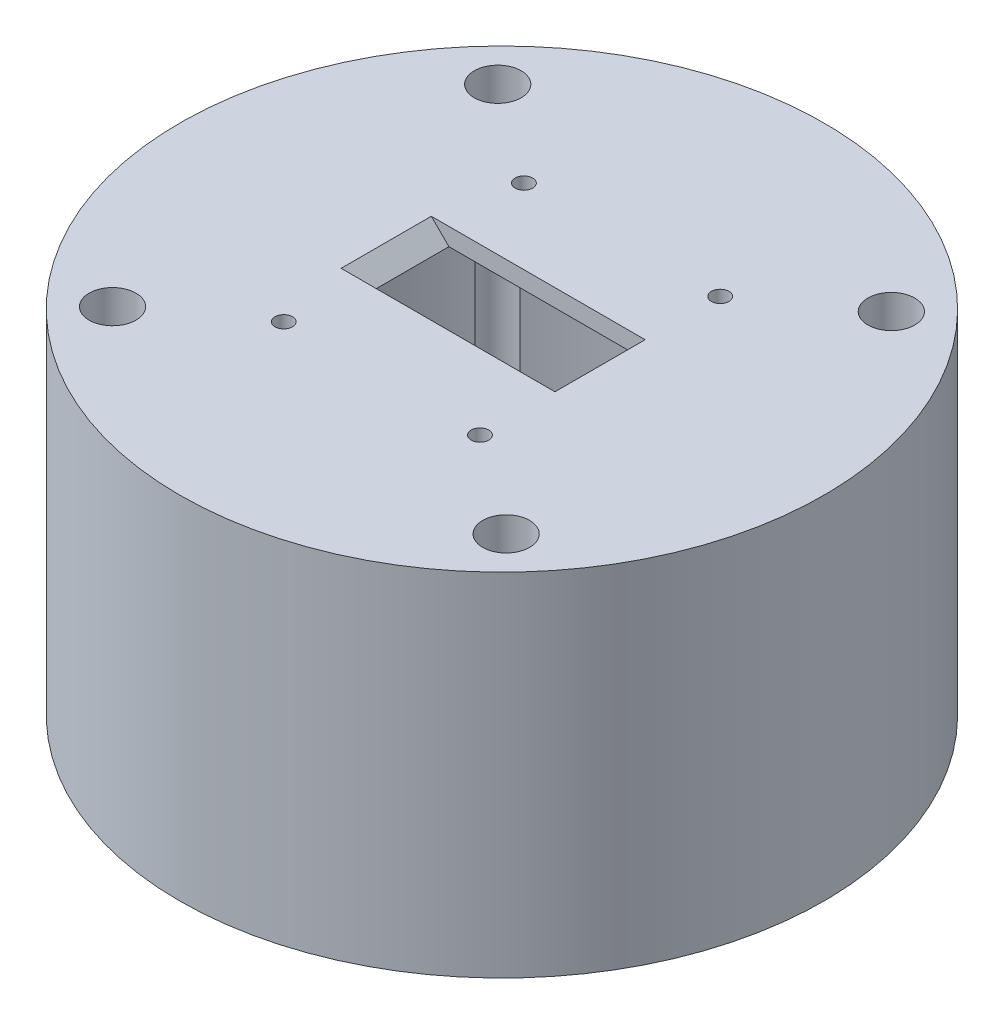
from build123d import *

# Parameters (mm, degrees)
SKETCH_1_R          = 55
EXTRUDE_1_DEPTH     = 60
SKETCH_2_R          = 50
CUT_EXTRUDE_1_DEPTH = 50
SKETCH_3_W          = 33.5
SKETCH_3_H          = 15.4
CUT_EXTRUDE_2_DEPTH = 93.466210045
SKETCH_4_R          = 1.5
SKETCH_4_R_2        = 4
CUT_EXTRUDE_3_DEPTH = 99.234413522
CUT_EXTRUDE_4_DEPTH = 7
CHAMFER_1_SIZE      = 3


with BuildPart() as part:
    # Эскиз1 → Бобышка-Вытянуть1 (new body)
    with BuildSketch(Plane(origin=(0, 0, 0), x_dir=(1, 0, 0), z_dir=(0, 1, 0))):
        with Locations(Location((0, 0, 0), (0, 0, 270))):
            Circle(SKETCH_1_R)
    extrude(amount=EXTRUDE_1_DEPTH)

    # Эскиз2 → Вырез-Вытянуть1 (cut)
    with BuildSketch(Plane.XZ):
        with Locations(Location((0, 0, 0), (0, 0, 270))):
            Circle(SKETCH_2_R)
    extrude(amount=-CUT_EXTRUDE_1_DEPTH, mode=Mode.SUBTRACT)

    # Эскиз3 → Вырез-Вытянуть2 (cut, through all)
    with BuildSketch(Plane.XZ.offset(-50)):
        Rectangle(SKETCH_3_W, SKETCH_3_H)
    extrude(amount=-CUT_EXTRUDE_2_DEPTH, mode=Mode.SUBTRACT)

    # Эскиз4 → Вырез-Вытянуть3 (cut, through all)
    with BuildSketch(Plane(origin=(0, 60, 0), x_dir=(1, 0, 0), z_dir=(0, 1, 0))):
        with Locations(Location((-16.75, 20.5, 0), (0, 0, 270))):
            Circle(SKETCH_4_R)
        with Locations(Location((16.75, 20.5, 0), (0, 0, 270))):
            Circle(SKETCH_4_R)
        with Locations(Location((-16.75, -20.5, 0), (0, 0, 270))):
            Circle(SKETCH_4_R)
        with Locations(Location((16.75, -20.5, 0), (0, 0, 270))):
            Circle(SKETCH_4_R)
        with Locations(Location((33.591727056, -32.872418125, 0), (0, 0, 270))):
            Circle(SKETCH_4_R_2)
        with Locations(Location((-33.591727056, -32.872418125, 0), (0, 0, 270))):
            Circle(SKETCH_4_R_2)
        with Locations(Location((-33.591727056, 32.872418125, 0), (0, 0, 270))):
            Circle(SKETCH_4_R_2)
        with Locations(Location((33.591727056, 32.872418125, 0), (0, 0, 270))):
            Circle(SKETCH_4_R_2)
    extrude(amount=-CUT_EXTRUDE_3_DEPTH, mode=Mode.SUBTRACT)

    # Эскиз6 → Вырез-Вытянуть4 (cut)
    with BuildSketch(Plane.XZ.offset(-50)):
        with BuildLine():
            Line((-22.5, -32.5), (22.5, -32.5))
            ThreePointArc((22.5, -32.5), (29.571067812, -29.571067812), (32.5, -22.5))
            Line((32.5, -22.5), (32.5, 22.5))
            ThreePointArc((32.5, 22.5), (29.571067812, 29.571067812), (22.5, 32.5))
            Line((22.5, 32.5), (-22.5, 32.5))
            ThreePointArc((-22.5, 32.5), (-29.571067812, 29.571067812), (-32.5, 22.5))
            Line((-32.5, 22.5), (-32.5, -22.5))
            ThreePointArc((-32.5, -22.5), (-29.571067812, -29.571067812), (-22.5, -32.5))
        make_face()
    extrude(amount=-CUT_EXTRUDE_4_DEPTH, mode=Mode.SUBTRACT)

    # Фаска1
    chamfer_1_edges = [part.edges().sort_by_distance(p)[0] for p in [
        (-16.75, 60, 0),
    ]]
    chamfer(chamfer_1_edges, length=CHAMFER_1_SIZE - 0.0001)  # a hair under: the kernel refuses the full size


solid = part.part
